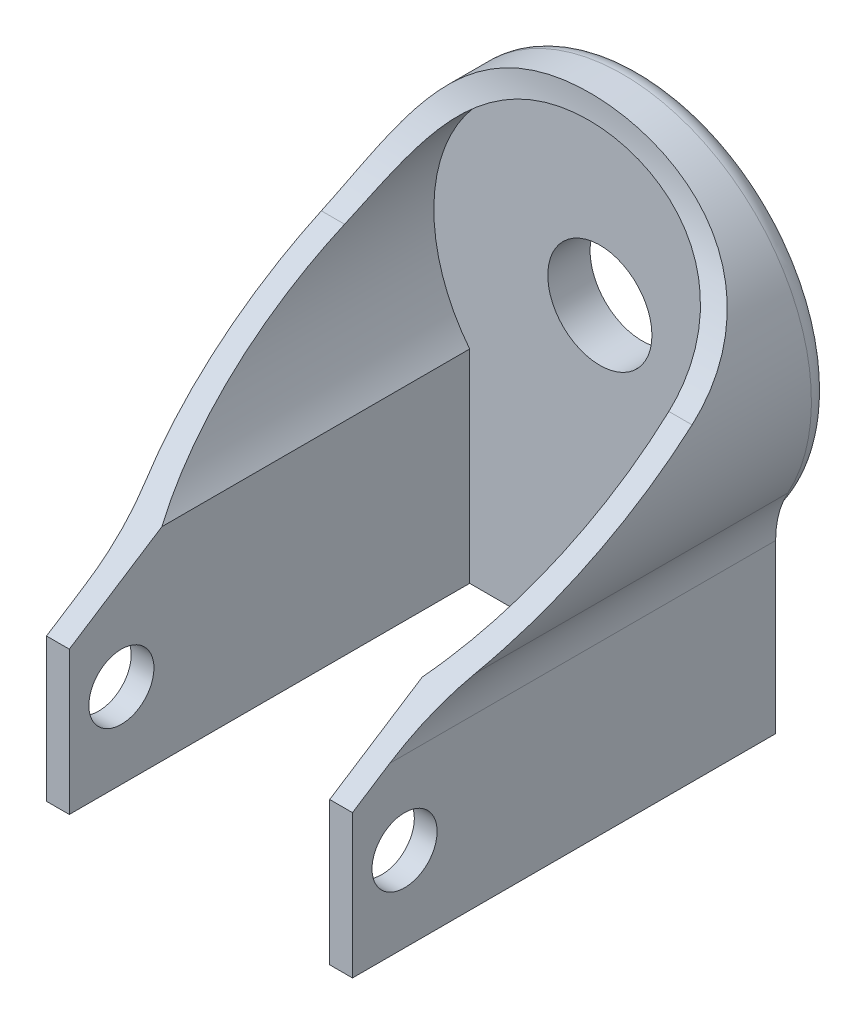
from build123d import *
from build123d.topology import SkipClean

# Parameters (mm, degrees)
EXTRUDE_1_DEPTH          = 65
SHELL_1_T                = -3.5
CUT_EXTRUDE_3_DEPTH      = 86.293611
CUT_EXTRUDE_3_DEPTH_BACK = 86.293611
FILLET_1_R               = 15
SKETCH_3_W               = 40
SKETCH_3_H               = 3.5
CUT_EXTRUDE_4_DEPTH      = 61.5
SKETCH_4_R               = 5
CUT_EXTRUDE_5_DEPTH      = 96.865792
EXTRUDE_START            = 3
SKETCH_5_R               = 29
EXTRUDE_2_DEPTH          = 3
FILLET_2_R               = 3
SKETCH_6_R               = 8
CUT_EXTRUDE_6_DEPTH      = 83.657426


with BuildPart() as part:
    # 草图1 → 凸台-拉伸1 (new body)
    with BuildSketch(Plane.XY):
        with BuildLine():
            Line((-23.5, -16.992645), (-23.5, -47))
            Line((-23.5, -47), (23.5, -47))
            Line((23.5, -47), (23.5, -16.992645))
            ThreePointArc((23.5, -16.992645), (0, 29), (-23.5, -16.992645))
        make_face()
    extrude(amount=EXTRUDE_1_DEPTH)

    # 抽壳1
    shell_1_openings = [part.faces().sort_by_distance(p)[0] for p in [
        (0, -9.973122, 65),
    ]]
    offset(amount=SHELL_1_T, openings=shell_1_openings, kind=Kind.INTERSECTION)

    # 草图2 → 切除-拉伸3 (cut, two sides: drawn at the far end of the back side and taken through both)
    with BuildSketch(Plane(origin=(0, 0, 0), x_dir=(0, 0, -1), z_dir=(1, 0, 0)).offset(-CUT_EXTRUDE_3_DEPTH_BACK)):
        with BuildLine():
            Line((-5, 232.659495), (-5, 29))
            ThreePointArc((-5, 29), (-8.409806, 15.608871), (-17.808738, 5.479252))
            Line((-17.808738, 5.479252), (-65, -25))
            Line((-65, -25), (-236.079414, -135.494453))
            Line((-236.079414, -135.494453), (-581.070507, 81.046318))
            Line((-581.070507, 81.046318), (-349.991093, 449.200266))
            Line((-349.991093, 449.200266), (-5, 232.659495))
        make_face()
    extrude(amount=CUT_EXTRUDE_3_DEPTH + CUT_EXTRUDE_3_DEPTH_BACK, mode=Mode.SUBTRACT)

    # 圆角1
    fillet_1_edges = [part.edges().sort_by_distance(p)[0] for p in [
        (-23.5, -16.992645, 26.301076),
        (23.5, -16.992645, 26.301076),
    ]]
    fillet(fillet_1_edges, radius=FILLET_1_R)

    # 草图3 → 切除-拉伸4 (cut)
    with BuildSketch(Plane.XY.offset(65)):
        with Locations((0, -45.25)):
            Rectangle(SKETCH_3_W, SKETCH_3_H)
    extrude(amount=-CUT_EXTRUDE_4_DEPTH, mode=Mode.SUBTRACT)

    # 草图4 → 切除-拉伸5 (cut, through all)
    with BuildSketch(Plane(origin=(23.5, 0, 0), x_dir=(0, 0, -1), z_dir=(1, 0, 0))):
        with Locations(Location((-57, -34, 0), (0, 0, 90))):
            Circle(SKETCH_4_R)
    extrude(amount=-CUT_EXTRUDE_5_DEPTH, mode=Mode.SUBTRACT)

    # 草图5 → 凸台-拉伸2 (add)
    with SkipClean():  # the faces are left unmerged after this step: merging them gives an invalid solid
        with BuildSketch(Plane(origin=(0, 0, 0), x_dir=(-1, 0, 0), z_dir=(0, 0, -1)).offset(EXTRUDE_START)):
            Circle(SKETCH_5_R)
        extrude(amount=-EXTRUDE_2_DEPTH)

    # 圆角2
    fillet_2_edges = [part.edges().sort_by_distance(p)[0] for p in [
        (29, 0, -3),
    ]]
    fillet(fillet_2_edges, radius=FILLET_2_R - 0.0001)  # a hair under: the kernel refuses the full size

    # 草图6 → 切除-拉伸6 (cut, through all)
    with BuildSketch(Plane.XY.offset(3.5)):
        Circle(SKETCH_6_R)
    extrude(amount=-CUT_EXTRUDE_6_DEPTH, mode=Mode.SUBTRACT)


solid = part.part
